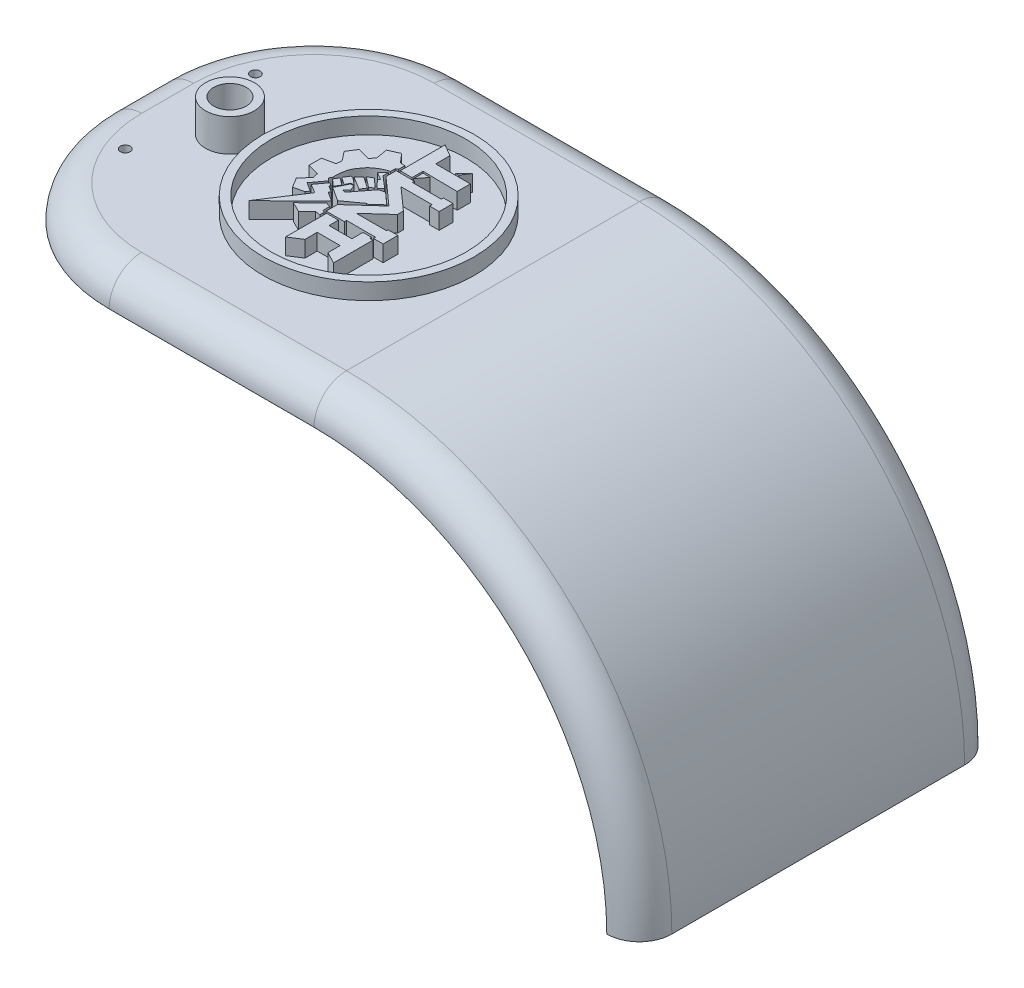
from build123d import *

# Parameters (mm, degrees)
SALIENTE_EXTRUIR1_DEPTH  = 10
SALIENTE_EXTRUIR2_DEPTH  = 10
SALIENTE_EXTRUIR3_DEPTH  = 10
CROQUIS7_W               = 6.482190187089472
CROQUIS7_H               = 5
CORTAR_EXTRUIR2_DEPTH    = 240
CROQUIS12_W              = 39.999999999999986
CROQUIS12_H              = 19.826794919243113
CORTAR_EXTRUIR5_DEPTH    = 137.10657588816198
CORTAR_EXTRUIR6_DEPTH    = 137.10657588816198
CORTAR_EXTRUIR7_DEPTH    = 208.12315177207984
CORTAR_EXTRUIR8_DEPTH    = 136
CROQUIS16_R              = 1.9999999999964995
CROQUIS16_R_2            = 1.9999999999964986
CROQUIS16_R_3            = 1.9999999999965128
CORTAR_EXTRUIR9_DEPTH    = 137.10657588816198
CROQUIS17_W              = 72.00000000000003
CROQUIS17_H              = 50
CROQUIS17_W_2            = 62
CROQUIS17_H_2            = 40
SALIENTE_EXTRUIR5_DEPTH  = 13.999999999999998
REDONDEO1_R              = 17
REDONDEO2_R              = 42
CROQUIS18_W              = 51.66819983661714
CROQUIS18_H              = 19.060878650806156
CORTAR_EXTRUIR10_DEPTH   = 50
CROQUIS19_W              = 158
CROQUIS19_H              = 20
SALIENTE_EXTRUIR6_DEPTH  = 5
CROQUIS20_W              = 158
CROQUIS20_H              = 20
SALIENTE_EXTRUIR7_DEPTH  = 5
REDONDEO3_R              = 400
CROQUIS21_W              = 24.99999999999999
CROQUIS21_H              = 10
CROQUIS21_W_2            = 24.999999999999982
SALIENTE_EXTRUIR8_DEPTH  = 10
SALIENTE_EXTRUIR10_DEPTH = 70
CROQUIS24_W              = 10.000000000000014
CROQUIS24_H              = 110.00000000000001
SALIENTE_EXTRUIR11_DEPTH = 150
SALIENTE_EXTRUIR12_DEPTH = 200
REDONDEO4_R              = 100
CORTAR_EXTRUIR14_DEPTH   = 200
REDONDEO5_R              = 47
CROQUIS28_W              = 220.68994699981482
CROQUIS28_H              = 80.7852485882588
CORTAR_EXTRUIR15_DEPTH   = 200.00000000000003
CROQUIS29_R              = 1.4999999999999973
CORTAR_EXTRUIR16_DEPTH   = 30
REDONDEO6_R              = 10
CROQUIS30_R              = 5.000000000000004
CORTAR_EXTRUIR17_DEPTH   = 30
SALIENTE_EXTRUIR13_START = 10
CROQUIS31_R              = 7.500000000000012
CROQUIS31_R_2            = 5.000000000000004
SALIENTE_EXTRUIR13_DEPTH = 10
SALIENTE_EXTRUIR14_DEPTH = 5
CROQUIS34_R              = 32.5
CROQUIS34_R_2            = 30
SALIENTE_EXTRUIR15_DEPTH = 5


# Some blends are built 0.0001 mm under size
with BuildPart() as part:
    # Croquis2 → Saliente-Extruir1 (new body)
    with BuildSketch(Plane(origin=(0, 0, 0), x_dir=(1, 0, 0), z_dir=(0, 1, 0))):
        Polygon((125, -49.999999999999986), (-125, -50.000000000000014), (-125, 49.999999999999986), (125, 50.000000000000014), align=None)
    extrude(amount=SALIENTE_EXTRUIR1_DEPTH)

    # Croquis5 → Saliente-Extruir2 (add)
    with BuildSketch(Plane(origin=(0, 10, 0), x_dir=(1, 0, 0), z_dir=(0, 1, 0))):
        Polygon((125, 50.000000000000014), (120, 50.000000000000014), (120, -50.000000000000014), (125, -49.999999999999986), align=None)
    extrude(amount=SALIENTE_EXTRUIR2_DEPTH)

    # Croquis6 → Saliente-Extruir3 (add)
    with BuildSketch(Plane(origin=(0, 10, 0), x_dir=(1, 0, 0), z_dir=(0, 1, 0))):
        Polygon((120, 50.000000000000014), (-125, 50.000000000000014), (-125, 39.999999999999986), (120, 40.000000000000014), align=None)
        Polygon((-125, -50.000000000000014), (120, -50.000000000000014), (120, -40.00000000000001), (-125, -40.000000000000014), align=None)
    extrude(amount=SALIENTE_EXTRUIR3_DEPTH)

    # Croquis7 → Cortar-Extruir2 (cut)
    with BuildSketch(Plane.ZY.offset(125)):
        with Locations((-43.24109509354475, 12.500000000000002)):
            Rectangle(CROQUIS7_W, CROQUIS7_H)
        with Locations((43.24109509354475, 12.500000000000002)):
            Rectangle(CROQUIS7_W, CROQUIS7_H)
    extrude(amount=-CORTAR_EXTRUIR2_DEPTH, mode=Mode.SUBTRACT)

    # Croquis12 → Cortar-Extruir5 (cut, through all)
    with BuildSketch(Plane(origin=(0, 0, 0), x_dir=(-1, 0, 0), z_dir=(0, -1, 0))):
        with Locations((89.08536720340675, -0.07666133309017908)):
            Rectangle(CROQUIS12_W, CROQUIS12_H)
    extrude(amount=-CORTAR_EXTRUIR5_DEPTH, mode=Mode.SUBTRACT)

    # Croquis13 → Cortar-Extruir6 (cut, through all)
    with BuildSketch(Plane.XZ):
        Polygon((125, 49.999999999999986), (75, 49.99999999999997), (75.00000000000003, -50.000000000000014), (125, -50.00000000000001), align=None)
    extrude(amount=-CORTAR_EXTRUIR6_DEPTH, mode=Mode.SUBTRACT)

    # Croquis14 → Cortar-Extruir7 (cut, through all)
    with BuildSketch(Plane.ZY.offset(125)):
        Polygon((-46.482190187089486, 15.000000000000002), (46.27511845592502, 15.000000000000002), (46.482190187089486, 15.000000000000002), (46.482190187089486, 16), (46.27511845592502, 16), (-46.482190187089486, 15.999999999999986), align=None)
    extrude(amount=-CORTAR_EXTRUIR7_DEPTH, mode=Mode.SUBTRACT)

    # Croquis15 → Cortar-Extruir8 (cut, through all)
    with BuildSketch(Plane(origin=(0, 10, 0), x_dir=(1, 0, 0), z_dir=(0, 1, 0))):
        Polygon((75.00000000000003, 30.000000000000018), (-24.999999999999982, 30.000000000000004), (-24.999999999999982, -30.00000000000003), (75.00000000000004, -30.000000000000018), align=None)
    extrude(amount=-CORTAR_EXTRUIR8_DEPTH, mode=Mode.SUBTRACT)

    # Croquis16 → Cortar-Extruir9 (cut, through all)
    with BuildSketch(Plane(origin=(0, 0, 0), x_dir=(-1, 0, 0), z_dir=(0, -1, 0))):
        with Locations(Location((65.08536720341093, -5.1632638734706395, 0), (0, 0, 90))):
            Circle(CROQUIS16_R)
        with Locations(Location((65.08536720341093, 4.8367361265293605, 0), (0, 0, 90))):
            Circle(CROQUIS16_R)
        with Locations(Location((113.08536720341093, 4.8367361265293605, 0), (0, 0, 90))):
            Circle(CROQUIS16_R_2)
        with Locations(Location((113.08536720341093, -5.1632638734706395, 0), (0, 0, 90))):
            Circle(CROQUIS16_R_3)
    extrude(amount=-CORTAR_EXTRUIR9_DEPTH, mode=Mode.SUBTRACT)

    # Croquis17 → Saliente-Extruir5 (add)
    with BuildSketch(Plane(origin=(0, 0, 0), x_dir=(-1, 0, 0), z_dir=(0, -1, 0))):
        with Locations((89, -7.11e-15)):
            Rectangle(CROQUIS17_W, CROQUIS17_H)
        with Locations((88.99999999999999, -1.066e-14)):
            Rectangle(CROQUIS17_W_2, CROQUIS17_H_2, mode=Mode.SUBTRACT)
    extrude(amount=SALIENTE_EXTRUIR5_DEPTH)

    # Redondeo1
    redondeo1_edges = [part.edges().sort_by_distance(p)[0] for p in [
        (-125, -6.999999999999999, -24.999999999999993),
        (-125, -6.999999999999999, 25.000000000000007),
    ]]
    fillet(redondeo1_edges, radius=REDONDEO1_R)

    # Redondeo2
    redondeo2_edges = [part.edges().sort_by_distance(p)[0] for p in [
        (-125, 10, -50),
        (-125, 10, 50.000000000000014),
    ]]
    fillet(redondeo2_edges, radius=REDONDEO2_R)

    # Croquis18 → Cortar-Extruir10 (cut)
    with BuildSketch(Plane(origin=(0, 0, 0), x_dir=(-1, 0, 0), z_dir=(0, -1, 0))):
        with Locations((-5.234199820630661, 39.53043932540307)):
            Rectangle(CROQUIS18_W, CROQUIS18_H)
    extrude(amount=-CORTAR_EXTRUIR10_DEPTH, mode=Mode.SUBTRACT)

    # Croquis19 → Saliente-Extruir6 (add)
    with BuildSketch(Plane(origin=(-5.55e-15, 0, -50), x_dir=(-1, 0, 1.1e-16), z_dir=(-1.1e-16, 0, -1))):
        with Locations((3.9999999999999787, 10)):
            Rectangle(CROQUIS19_W, CROQUIS19_H)
    extrude(amount=SALIENTE_EXTRUIR6_DEPTH)

    # Croquis20 → Saliente-Extruir7 (add)
    with BuildSketch(Plane.XY.offset(50)):
        with Locations((-3.999999999999993, 10)):
            Rectangle(CROQUIS20_W, CROQUIS20_H)
    extrude(amount=SALIENTE_EXTRUIR7_DEPTH)

    # Redondeo3
    # the kernel refuses this fillet: 400 mm, written as the material it takes off along each edge
    with BuildSketch(Plane(origin=(-82.99999999999999, 177.61900266148098, -54.99999999999999), x_dir=(1, 0, -1.1e-16), z_dir=(0, -1, 0))) as redondeo3_piece_1:
        with BuildLine():
            CenterArc((63.0476010645924, 400.00000000000017), REDONDEO3_R, 260.9312784539673, 9.068721546032691)
            Line((-1.477e-14, 4.999999999999993), (0, 0))
            Line((0, 0), (63.04760106459239, 0))
        make_face()
    extrude(amount=335.23800532296195, mode=Mode.SUBTRACT)
    with BuildSketch(Plane(origin=(-82.99999999999999, -157.61900266148086, 55), x_dir=(-2.84e-15, 0, -1), z_dir=(0, 1, 0))) as redondeo3_piece_2:
        with BuildLine():
            CenterArc((400, -63.04760106459348), REDONDEO3_R, 170.93127845396717, 9.068721546032691)
            Line((-1.7919e-13, -63.04760106459234), (0, 0))
            Line((0, 0), (5, 0))
        make_face()
    extrude(amount=335.2380053229617, mode=Mode.SUBTRACT)

    # Croquis21 → Saliente-Extruir8 (add)
    with BuildSketch(Plane(origin=(75.00000000000001, 0, 2.082e-14), x_dir=(2.8e-16, 0, -1), z_dir=(1, 0, 2.8e-16))):
        with Locations((-42.49999999999999, 5)):
            Rectangle(CROQUIS21_W, CROQUIS21_H)
        with Locations((42.50000000000003, 5)):
            Rectangle(CROQUIS21_W_2, CROQUIS21_H)
    extrude(amount=SALIENTE_EXTRUIR8_DEPTH)

    # Croquis23 → Saliente-Extruir10 (add)
    with BuildSketch(Plane.XY.offset(-30.000000000000007)):
        Polygon((84.99999999999999, 10), (75, 9.999999999999998), (75, 0), (84.99999999999999, 0), align=None)
    extrude(amount=SALIENTE_EXTRUIR10_DEPTH)

    # Croquis24 → Saliente-Extruir11 (add)
    with BuildSketch(Plane(origin=(0, 10, 0), x_dir=(1, 0, 0), z_dir=(0, 1, 0))):
        with Locations((80, 0)):
            Rectangle(CROQUIS24_W, CROQUIS24_H)
    extrude(amount=SALIENTE_EXTRUIR11_DEPTH)

    # Croquis25 → Saliente-Extruir12 (add)
    with BuildSketch(Plane.ZY.offset(-75)):
        Polygon((-55.00000000000001, 160), (55, 160), (55, 60), (-54.999999999999986, 60), align=None)
    extrude(amount=SALIENTE_EXTRUIR12_DEPTH)

    # Redondeo4
    redondeo4_edges = [part.edges().sort_by_distance(p)[0] for p in [
        (85.00000000000001, 160, 0),
    ]]
    fillet(redondeo4_edges, radius=REDONDEO4_R)

    # Croquis27 → Cortar-Extruir14 (cut)
    with BuildSketch(Plane.XY.offset(55)):
        with BuildLine():
            Line((-14.932593390467204, 60.00000000000003), (48.629021308787976, 123.62226411216857))
            ThreePointArc((48.62902130878722, 123.62226411216932), (19.46330858167523, 143.09508578404547), (-14.932593390467243, 149.93259339046722))
            Line((-14.932593390467233, 149.93259339046722), (-125, 149.93259339046722))
            Line((-125, 149.93259339046722), (-125, 60))
            Line((-125, 60), (-14.93259339046719, 60))
        make_face()
        with BuildLine():
            ThreePointArc((75, 60), (68.14608078023889, 94.43552311164675), (48.629021308787216, 123.62226411216932))
            Line((48.629021308787976, 123.62226411216857), (-14.932593390467204, 60.00000000000003))
            Line((-14.93259339046719, 60), (75, 60))
        make_face()
    extrude(amount=-CORTAR_EXTRUIR14_DEPTH, mode=Mode.SUBTRACT)

    # Redondeo5
    redondeo5_edges = [part.edges().sort_by_distance(p)[0] for p in [
        (-125, 154.9662966952336, -55.00000000000001),
        (-125, 154.9662966952336, 55),
    ]]
    fillet(redondeo5_edges, radius=REDONDEO5_R)

    # Croquis28 → Cortar-Extruir15 (cut)
    with BuildSketch(Plane.XY.offset(55)):
        with Locations((-25.344973499907432, 19.60737570587061)):
            Rectangle(CROQUIS28_W, CROQUIS28_H)
    extrude(amount=-CORTAR_EXTRUIR15_DEPTH, mode=Mode.SUBTRACT)

    # Croquis29 → Cortar-Extruir16 (cut)
    with BuildSketch(Plane(origin=(0, 160, 0), x_dir=(1, 0, 0), z_dir=(0, 1, 0))):
        with Locations(Location((-108.0324228940755, 19.999999999999986, 0), (0, 0, 270))):
            Circle(CROQUIS29_R)
        with Locations(Location((-108.0324228940755, -19.999999999999986, 0), (0, 0, 90))):
            Circle(CROQUIS29_R)
    extrude(amount=-CORTAR_EXTRUIR16_DEPTH, mode=Mode.SUBTRACT)

    # Redondeo6
    redondeo6_edges = [part.edges().sort_by_distance(p)[0] for p in [
        (55.710678118654755, 130.71067811865478, 55),
        (55.710678118654755, 130.71067811865478, -55),
        (-46.499999999999986, 160, -55.00000000000001),
        (-111.23401871576773, 160, -41.23401871576773),
        (-125, 160, 7.11e-15),
        (-111.23401871576775, 160, 41.23401871576774),
        (-46.499999999999986, 160, 55),
    ]]
    fillet(redondeo6_edges, radius=REDONDEO6_R - 0.0001)  # a hair under: the kernel refuses the full size

    # Croquis30 → Cortar-Extruir17 (cut)
    with BuildSketch(Plane(origin=(0, 160, 0), x_dir=(1, 0, 0), z_dir=(0, 1, 0))):
        with Locations(Location((-95.85437460392961, 0, 0), (0, 0, 270))):
            Circle(CROQUIS30_R)
    extrude(amount=-CORTAR_EXTRUIR17_DEPTH, mode=Mode.SUBTRACT)

    # Croquis31 → Saliente-Extruir13 (add)
    with BuildSketch(Plane(origin=(0, 160, 0), x_dir=(1, 0, 0), z_dir=(0, 1, 0)).offset(SALIENTE_EXTRUIR13_START)):
        with Locations(Location((-95.85437460392961, 0, 0), (0, 0, 90))):
            Circle(CROQUIS31_R)
        with Locations(Location((-95.85437460392961, 0, 0), (0, 0, 270))):
            Circle(CROQUIS31_R_2, mode=Mode.SUBTRACT)
    extrude(amount=-SALIENTE_EXTRUIR13_DEPTH)

    # Croquis33 → Saliente-Extruir14 (add)
    with BuildSketch(Plane(origin=(0, 160, 0), x_dir=(1, 0, 0), z_dir=(0, 1, 0))):
        Polygon((-38.117515346677884, -6.12242266584969), (-38.117515346677884, -10.65769777565028), (-41.06972272947261, -10.65769777565028), (-41.06972272947261, -10.015913561999254), (-50.01191610634359, -10.015913561999255), (-50.01191610634359, -10.657697775650314), (-55.61683157222923, -10.657697775650316), (-55.61683157222923, -7.192063021934738), (-47.31642240900928, 0.33820508490398465), (-55.61683157222923, 7.740116349012494), (-55.61683157222923, 10.863466188780826), (-50.01191610634359, 10.863466188780826), (-50.01191610634359, 10.2216819751298), (-41.06972272947261, 10.2216819751298), (-41.06972272947261, 10.863466188780826), (-38.117515346677884, 10.863466188780826), (-38.117515346677884, 6.584904764441278), (-41.06972272947261, 6.584904764441277), (-41.06972272947261, 7.343174667737044), (-50.61091470575124, 7.343174667737087), (-43.764321009674674, 1.237707093400772), (-43.764321009674674, -0.6030784284508549), (-50.38341220711759, -6.608027143656801), (-41.06972272947261, -6.608027143656801), (-41.06972272947261, -6.12242266584969), align=None)
        Polygon((-51.33827014788905, 11.462464788188452), (-54.9750473585782, 11.462464788188452), (-54.9750473585782, 25.269382504534214), (-51.33827014788905, 23.112987546666762), (-51.33827014788905, 18.74885489383978), (-40.693209324130706, 18.74885489383978), (-40.69320932413071, 14.692778663565319), (-51.33827014788905, 14.847829854323445), align=None)
        Polygon((-54.9750473585782, -11.16720408940166), (-51.33827014788905, -11.16720408940166), (-51.33827014788905, -14.072189150383194), (-44.28620872777003, -14.072189150383194), (-44.28620872777003, -10.65769777565028), (-41.63505731289368, -10.65769777565028), (-41.63505731289368, -11.16720408940166), (-40.693209324130706, -11.16720408940166), (-40.693209324130706, -23.32301536399429), (-44.28620872777003, -21.433364887433488), (-44.286208727770045, -17.682267672768013), (-51.33827014788905, -17.682267672768013), (-51.33827014788905, -21.433364887433488), (-54.9750473585782, -23.774275179292395), align=None)
        Polygon((-62.59462146274, -2.554492998067305), (-61.771918043403794, -3.0344033260134267), (-61.771918043403794, -3.651430890515562), (-59.93753097196505, -4.721490015521502), (-60.28813903538683, -5.322532409958829), (-57.429872219129386, -7.1920630219346995), (-70.24803394945285, -19.706453590437818), (-62.260656910466516, -7.494802926241075), (-65.03919567539879, -5.873988646697241), align=None)
        Polygon((-56.2823127791034, 9.137810604094787), (-57.98060813082428, 7.479762298944238), (-55.71297362830317, 6.156975505806914), (-56.07808956295412, 5.531062474976714), (-53.81923189223746, 3.217373862612143), (-52.63430663900381, 4.374218168794424), (-56.2823127791034, 7.479762298944238), align=None)
        Polygon((-50.80951860231027, 14.314956086041445), (-48.60560437862547, 14.314956086041445), (-50.80951860231027, 11.462464788188452), align=None)
        Polygon((-45.807987549362515, 19.29861734092767), (-44.791631387522116, 19.29861734092767), (-43.13934287860839, 21.842346729220964), align=None)
        Polygon((-51.517543238496614, 3.505572943989393), (-47.97620887750428, 0.33820508490397766), (-50.877503532810834, -2.4272842886648287), (-51.51754323849662, -2.4272842886648096), (-56.6343001098924, -6.12242266584969), (-60.91346028932374, -3.3428788885851404), (-59.07149219863618, 0.338205084903989), (-58.10200142300329, 0.33820508490398465), (-57.429872219129386, -1.301485485190323), (-58.71985102757551, -2.531082306858115), (-57.76593682106634, -2.7691867983012175), (-53.230583770014846, 3.100848873588733), align=None)
        Polygon((-54.26443376945646, 3.0073624065113838), (-55.407503013064265, 2.181878777721594), (-58.586746810819726, 4.6382510834701804), (-56.99712491194199, 5.587231787853128), align=None)
        Polygon((-55.407503013064265, 1.7965820391618805), (-56.41946161046694, 0.2386526520952118), (-60.431472314454524, 2.6976639642953235), (-58.86596422487997, 4.189892951804686), align=None)
        Polygon((-58.242893924320924, 0.5836354674291729), (-59.22675346758371, 0.5836354674291728), (-59.93753097196505, -0.8368189331234974), (-62.188998173438, 0.7212326663372931), (-61.15805436795697, 2.403273559064582), (-60.431472314454524, 2.403273559064582), align=None)
        Polygon((-60.11580811154041, -1.301485485190323), (-61.15805436795697, -3.001966941370772), (-63.18384928236409, -1.0894616489493472), (-62.308814565954215, 0.33820508490399204), align=None)
        with BuildLine():
            Line((-56.2823127791034, 9.808298754636006), (-56.2823127791034, 11.238176864512091))
            Line((-56.2823127791034, 11.238176864512091), (-55.61683157222923, 11.659807589219144))
            Line((-55.61683157222923, 11.659807589219144), (-55.61683157222923, 13.547979965081153))
            Line((-55.61683157222923, 13.547979965081153), (-56.99712491194199, 13.547979965081153))
            Line((-56.99712491194199, 13.547979965081153), (-59.347733017437236, 16.2977455609967))
            Line((-59.347733017437236, 16.2977455609967), (-62.59462146274, 14.847829854323445))
            Line((-62.59462146274, 14.847829854323445), (-61.98750798951615, 11.238176864512091))
            Line((-61.98750798951615, 11.238176864512091), (-63.18384928236409, 9.808298754636006))
            Line((-63.18384928236409, 9.808298754636006), (-66.9187542915247, 10.863466188780826))
            Line((-66.9187542915247, 10.863466188780826), (-68.7519313554684, 7.993453461331745))
            Line((-68.7519313554684, 7.993453461331745), (-66.5178784876363, 5.144739826018503))
            Line((-66.5178784876363, 5.144739826018503), (-66.71610352376848, 3.505572943989393))
            Line((-66.71610352376848, 3.505572943989393), (-70.43845425429662, 2.6976639642953235))
            Line((-70.43845425429662, 2.6976639642953235), (-70.43845425429662, -1.0894616489493472))
            Line((-70.43845425429662, -1.0894616489493472), (-66.9187542915247, -2.083830386459036))
            Line((-66.9187542915247, -2.083830386459036), (-66.5785180764326, -3.651430890515562))
            Line((-66.5785180764326, -3.651430890515562), (-68.96300917618048, -6.501396570967273))
            Line((-68.96300917618048, -6.501396570967273), (-67.13028540565475, -9.494558731975088))
            Line((-67.13028540565475, -9.494558731975088), (-64.06689068372387, -8.700380447194284))
            Line((-64.06689068372387, -8.700380447194284), (-63.38072255811336, -7.7757733192319565))
            Line((-63.38072255811336, -7.7757733192319565), (-66.11041101217609, -6.032226254844067))
            Line((-66.11041101217609, -6.032226254844067), (-63.30918265695389, -2.2575890957889357))
            Line((-63.30918265695389, -2.2575890957889357), (-64.06689068372387, -1.431617577582068))
            Line((-64.06689068372387, -1.431617577582068), (-63.61903557642605, -0.6030784284508549))
            add(Edge.make_bspline(
                [(-56.2823127791034, 9.808298754636006), (-57.45901550123837, 9.486876113271972), (-59.086752551509896, 8.697435066185367), (-60.983853834492194, 7.2082174125363805), (-61.951127535417754, 5.779234595687623), (-63.00727376316022, 4.397763136658559), (-63.53352486990615, 2.1790504604888956), (-63.6793669268937, 0.5103133959417523), (-63.61903557642605, -0.6030784284508549)],
                knots=[0, 0, 0, 0, 0.2626415751868557, 0.38886677520063195, 0.5157732496929434, 0.6347262597991598, 0.7608344902006009, 1, 1, 1, 1], degree=3))
        make_face()
        Polygon((-57.76593682106634, -8.419641041911063), (-56.2823127791034, -8.881914773830601), (-56.2823127791034, -11.040333303530048), (-55.61683157222923, -11.247686697869103), (-55.61683157222923, -12.618223484412994), (-57.22388416829283, -12.357503657742797), (-59.709591457068, -15.012664004661502), (-62.88576475084856, -13.476821946635908), align=None)
    extrude(amount=SALIENTE_EXTRUIR14_DEPTH)

    # Croquis34 → Saliente-Extruir15 (add)
    with BuildSketch(Plane(origin=(0, 160, 0), x_dir=(1, 0, 0), z_dir=(0, 1, 0))):
        with Locations(Location((-53.190599993590716, 0, 0), (0, 0, 90))):
            Circle(CROQUIS34_R)
        with Locations(Location((-53.190599993590716, 0, 0), (0, 0, 270))):
            Circle(CROQUIS34_R_2, mode=Mode.SUBTRACT)
    extrude(amount=SALIENTE_EXTRUIR15_DEPTH)


solid = part.part
